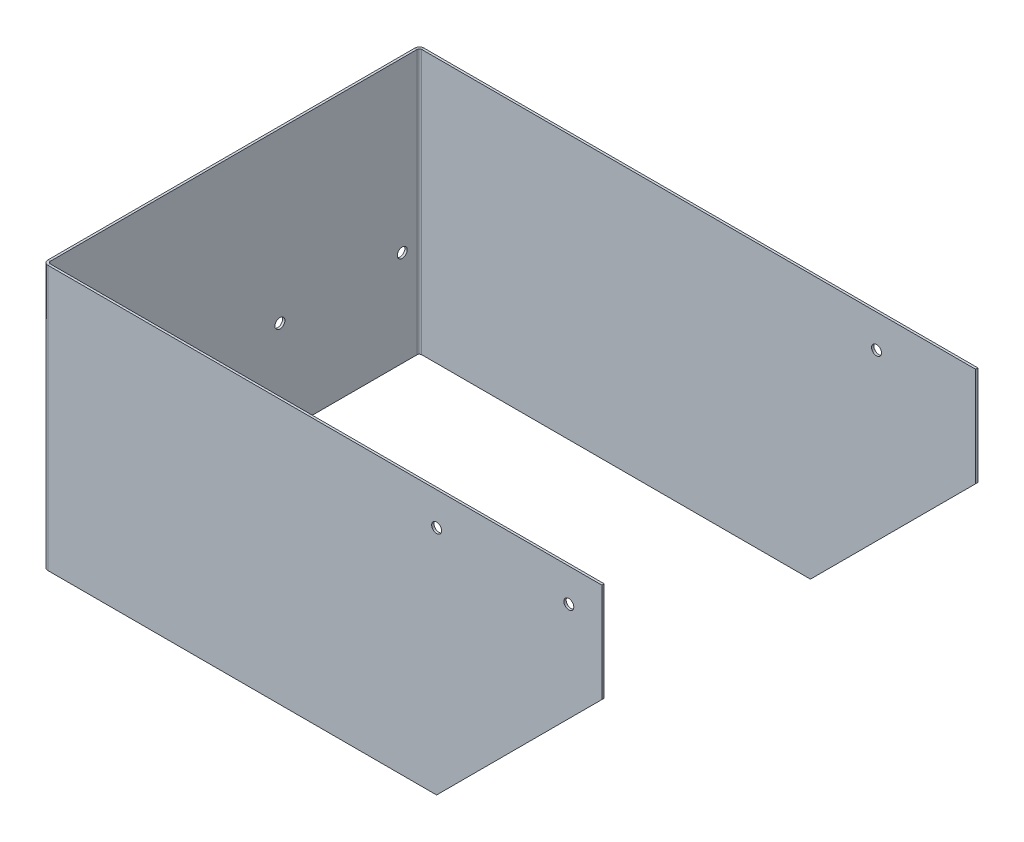
from build123d import *

# Parameters (mm, degrees)
BASE_FLANGE1_DEPTH      = 80
CUT_EXTRUDE1_DEPTH      = 219.886820069
CUT_EXTRUDE1_DEPTH_BACK = 219.886820069
SKETCH7_R               = 1.5
CUT_EXTRUDE3_DEPTH      = 0.7
SKETCH8_R               = 1.5
CUT_EXTRUDE4_DEPTH      = 0.7
SKETCH9_R               = 1.5
CUT_EXTRUDE5_DEPTH      = 0.7


# Sheet-metal steps are written as plain solids
with BuildPart() as part:
    # Sketch1 → Base-Flange1 (new body)
    with BuildSketch(Plane(origin=(0, 0, 0), x_dir=(1, 0, 0), z_dir=(0, 1, 0))):
        with BuildLine():
            Line((169, 56.9), (1.4, 56.9))
            ThreePointArc((1.4, 56.9), (0.410050506, 56.489949494), (0, 55.5))
            Line((0, 55.5), (0, 0))
            Line((0, 0), (0, -55.5))
            ThreePointArc((0, -55.5), (0.410050506, -56.489949494), (1.4, -56.9))
            Line((1.4, -56.9), (169, -56.9))
            Line((169, -56.9), (169, -56.2))
            Line((169, -56.2), (1.4, -56.2))
            ThreePointArc((1.4, -56.2), (0.905025253, -55.994974747), (0.7, -55.5))
            Line((0.7, -55.5), (0.7, 0))
            Line((0.7, 0), (0.7, 55.5))
            ThreePointArc((0.7, 55.5), (0.905025253, 55.994974747), (1.4, 56.2))
            Line((1.4, 56.2), (169, 56.2))
            Line((169, 56.2), (169, 56.9))
        make_face()
    extrude(amount=BASE_FLANGE1_DEPTH)

    # Sketch6 → Cut-Extrude1 (cut, two sides: drawn at the far end of the back side and taken through both)
    with BuildSketch(Plane.XY.offset(56.9).offset(-CUT_EXTRUDE1_DEPTH_BACK)):
        Polygon((169, 50), (169, 0), (119, 0), align=None)
    extrude(amount=CUT_EXTRUDE1_DEPTH + CUT_EXTRUDE1_DEPTH_BACK, mode=Mode.SUBTRACT)

    # Sketch7 → Cut-Extrude3 (cut)
    with BuildSketch(Plane.XY.offset(56.9)):
        with Locations((159, 70)):
            Circle(SKETCH7_R)
        with Locations((119, 70)):
            Circle(SKETCH7_R)
    extrude(amount=-CUT_EXTRUDE3_DEPTH, mode=Mode.SUBTRACT)

    # Sketch8 → Cut-Extrude4 (cut)
    with BuildSketch(Plane.XY.offset(-56.9)):
        with Locations((139, 70)):
            Circle(SKETCH8_R)
    extrude(amount=CUT_EXTRUDE4_DEPTH, mode=Mode.SUBTRACT)

    # Sketch9 → Cut-Extrude5 (cut)
    with BuildSketch(Plane.ZY):
        with Locations((-51, 29)):
            Circle(SKETCH9_R)
        with Locations((-14, 29)):
            Circle(SKETCH9_R)
        with Locations(Location((14, 29, 0), (0, 0, 180))):
            Circle(SKETCH9_R)
        with Locations(Location((51, 29, 0), (0, 0, 180))):
            Circle(SKETCH9_R)
    extrude(amount=-CUT_EXTRUDE5_DEPTH, mode=Mode.SUBTRACT)


solid = part.part
